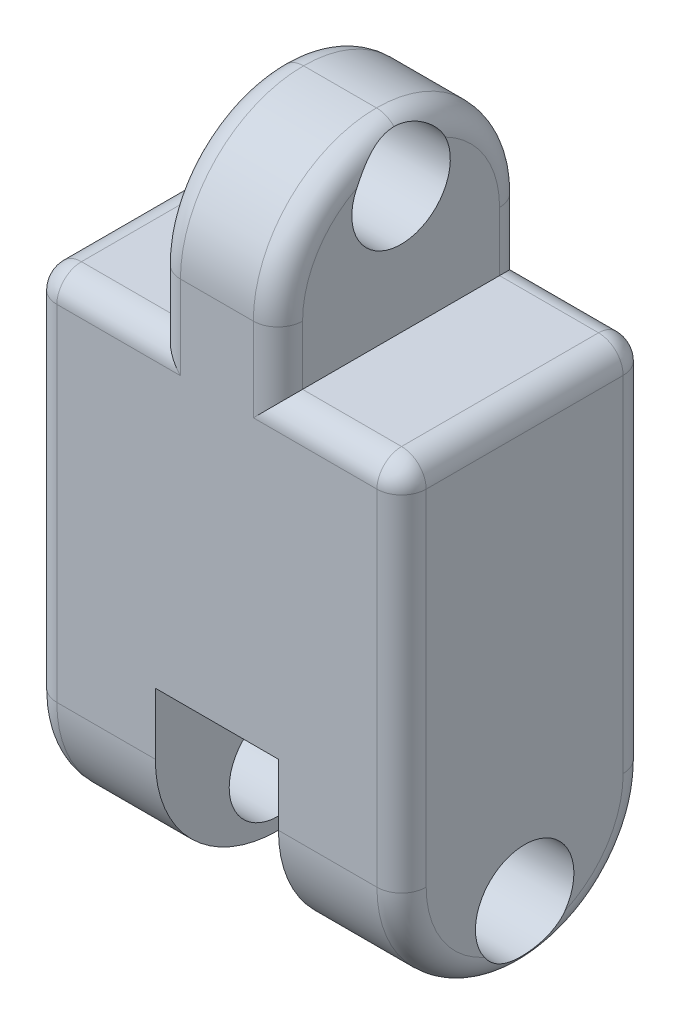
from build123d import *

# Parameters (mm, degrees)
BOSS_EXTRUDE1_DEPTH    = 100
SKETCH2_W              = 50
SKETCH2_H              = 50
CUT_EXTRUDE1_DEPTH     = 215.245186644
FILLET1_R              = 50
CUT_EXTRUDE2_DEPTH     = 25
SKETCH7_R              = 20
CUT_EXTRUDE3_DEPTH     = 251.551391934
FILLET2_R              = 50
CUT_EXTRUDE6_START     = -100
CUT_EXTRUDE6_OUTLINE_W = 50
CUT_EXTRUDE6_OUTLINE_H = 6.698729811
CUT_EXTRUDE6_DEPTH     = 50
CUT_EXTRUDE7_DEPTH     = 25
FILLET3_R              = 10
SKETCH11_W             = 50
SKETCH11_H             = 25
CUT_EXTRUDE8_DEPTH     = 99
BOSS_EXTRUDE7_DEPTH    = 0.1
FILLET4_R              = 10
FILLET5_R              = 10
SKETCH14_R             = 20
CUT_EXTRUDE9_DEPTH     = 225.178611948


with BuildPart() as part:
    # Sketch1 → Boss-Extrude1 (new body)
    with BuildSketch(Plane.XY):
        Polygon((-24.8, 100), (-24.8, 174), (24.8, 174), (24.8, 100), (75, 100), (75, -100), (-75, -100), (-75, 100), align=None)
    extrude(amount=-BOSS_EXTRUDE1_DEPTH)

    # Sketch2 → Cut-Extrude1 (cut, through all)
    with BuildSketch(Plane.XY):
        with Locations((0, -100)):
            Rectangle(SKETCH2_W, SKETCH2_H)
    extrude(amount=-CUT_EXTRUDE1_DEPTH, mode=Mode.SUBTRACT)

    # Fillet1
    fillet1_edges = [part.edges().sort_by_distance(p)[0] for p in [
        (0, 174, -100),
        (0, 174, 0),
    ]]
    fillet(fillet1_edges, radius=FILLET1_R - 0.0001)  # a hair under: the kernel refuses the full size

    # Sketch6 → Cut-Extrude2 (cut, symmetric)
    with BuildSketch(Plane(origin=(0, 0, 0), x_dir=(0, 0, -1), z_dir=(1, 0, 0))):
        with BuildLine():
            Line((100, -75), (0, -75))
            ThreePointArc((0, -75), (50, -25), (100, -75))
        make_face()
    extrude(amount=CUT_EXTRUDE2_DEPTH, both=True, mode=Mode.SUBTRACT)

    # Sketch7 → Cut-Extrude3 (cut, through all)
    with BuildSketch(Plane.ZY.offset(75)):
        with Locations(Location((-50, -75, 0), (0, 0, 270))):
            Circle(SKETCH7_R)
    extrude(amount=-CUT_EXTRUDE3_DEPTH, mode=Mode.SUBTRACT)

    # Fillet2
    fillet2_edges = [part.edges().sort_by_distance(p)[0] for p in [
        (-50, -100, -100),
        (-50, -100, 0),
    ]]
    fillet(fillet2_edges, radius=FILLET2_R - 0.0001)  # a hair under: the kernel refuses the full size

    # Cut-Extrude6: read off the stored shape, not the designer's step
    # Cut-Extrude6 outline → Cut-Extrude6 (cut)
    with BuildSketch(Plane(origin=(0, 0, 0), x_dir=(1, 0, 0), z_dir=(0, 1, 0)).offset(CUT_EXTRUDE6_START)):
        with Locations((0, 96.650635095)):
            Rectangle(CUT_EXTRUDE6_OUTLINE_W, CUT_EXTRUDE6_OUTLINE_H)
        with Locations((0, 3.349364906)):
            Rectangle(CUT_EXTRUDE6_OUTLINE_W, CUT_EXTRUDE6_OUTLINE_H)
    extrude(amount=CUT_EXTRUDE6_DEPTH, mode=Mode.SUBTRACT)

    # Sketch10 → Cut-Extrude7 (cut, symmetric)
    with BuildSketch(Plane(origin=(0, 0, 0), x_dir=(0, 0, -1), z_dir=(1, 0, 0))):
        with BuildLine():
            Line((0, -50), (100, -50))
            ThreePointArc((100, -50), (50, -36.611517322), (0, -50))
        make_face()
    extrude(amount=CUT_EXTRUDE7_DEPTH, both=True, mode=Mode.SUBTRACT)

    # Fillet3
    # the kernel refuses this fillet: 10 mm, written as the material it takes off along each edge
    with BuildSketch(Plane(origin=(24.8, 124.0001, -100), x_dir=(0, 0, 1), z_dir=(0, -1, 0)), Plane(origin=(-24.8, 100, 0), x_dir=(1, 0, 0), z_dir=(0, 1, 0)), Plane(origin=(-24.8, 100, -100), x_dir=(0, 0, 1), z_dir=(0, 1, 0)), Plane(origin=(24.8, 124.0001, 0), x_dir=(-1, 0, 0), z_dir=(0, -1, 0))) as fillet3_piece_1:
        with BuildLine():
            CenterArc((FILLET3_R, FILLET3_R), FILLET3_R, 180, 90)
            Line((0, FILLET3_R), (0, 0))
            Line((0, 0), (FILLET3_R, 0))
        make_face()
    extrude(amount=24.0001, mode=Mode.SUBTRACT)
    with BuildSketch(Plane(origin=(24.8, 100, 0), x_dir=(0, -1, 0), z_dir=(1, 0, 0)), Plane(origin=(-100, 100, -100), x_dir=(0, 0, 1), z_dir=(1, 0, 0)), Plane(origin=(24.8, 100, -100), x_dir=(0, 0, 1), z_dir=(1, 0, 0)), Plane(origin=(-100, 100, 0), x_dir=(0, -1, 0), z_dir=(1, 0, 0))) as fillet3_piece_2:
        with BuildLine():
            CenterArc((FILLET3_R, FILLET3_R), FILLET3_R, 180, 90)
            Line((0, FILLET3_R), (0, 0))
            Line((0, 0), (FILLET3_R, 0))
        make_face()
    extrude(amount=75.2, mode=Mode.SUBTRACT)
    with BuildSketch(Plane(origin=(-75, -50.0001, -100), x_dir=(0, 0, 1), z_dir=(0, 1, 0)), Plane(origin=(75, 125, 0), x_dir=(-1, 0, 0), z_dir=(0, -1, 0)), Plane(origin=(75, 125, -100), x_dir=(0, 0, 1), z_dir=(0, -1, 0)), Plane(origin=(-75, -50.0001, 0), x_dir=(1, 0, 0), z_dir=(0, 1, 0))) as fillet3_piece_3:
        with BuildLine():
            CenterArc((FILLET3_R, FILLET3_R), FILLET3_R, 180, 90)
            Line((0, FILLET3_R), (0, 0))
            Line((0, 0), (FILLET3_R, 0))
        make_face()
    extrude(amount=175.0001, mode=Mode.SUBTRACT)
    with BuildSketch(Plane(origin=(-24.8, 124.0001, -49.9999), x_dir=(0, 1, 0), z_dir=(0, 0, -1))) as fillet3_piece_4:
        with BuildLine():
            CenterArc((49.9999 - FILLET3_R, FILLET3_R), FILLET3_R, 270, 90)
            Line((49.9999 - FILLET3_R, 0), (49.9999, 0))
            Line((49.9999, 0), (49.9999, FILLET3_R))
        make_face()
    revolve(axis=Axis((-24.8, 124.0001, -49.9999), (1, 0, 0)), revolution_arc=90, mode=Mode.SUBTRACT)
    with BuildSketch(Plane(origin=(-24.8, 124.0001, -50.0001), x_dir=(0, 1, 0), z_dir=(0, 0, 1))) as fillet3_piece_5:
        with BuildLine():
            CenterArc((49.9999 - FILLET3_R, -FILLET3_R), FILLET3_R, 0, 90)
            Line((49.9999, -FILLET3_R), (49.9999, 0))
            Line((49.9999, 0), (49.9999 - FILLET3_R, 0))
        make_face()
    revolve(axis=Axis((-24.8, 124.0001, -50.0001), (-1, 0, 0)), revolution_arc=90, mode=Mode.SUBTRACT)
    with BuildSketch(Plane(origin=(24.8, 124.0001, -49.9999), x_dir=(0, 1, 0), z_dir=(0, 0, -1))) as fillet3_piece_6:
        with BuildLine():
            CenterArc((49.9999 - FILLET3_R, -FILLET3_R), FILLET3_R, 0, 90)
            Line((49.9999, -FILLET3_R), (49.9999, 0))
            Line((49.9999, 0), (49.9999 - FILLET3_R, 0))
        make_face()
    revolve(axis=Axis((24.8, 124.0001, -49.9999), (1, 0, 0)), revolution_arc=90, mode=Mode.SUBTRACT)
    with BuildSketch(Plane(origin=(24.8, 124.0001, -50.0001), x_dir=(0, 1, 0), z_dir=(0, 0, 1))) as fillet3_piece_7:
        with BuildLine():
            CenterArc((49.9999 - FILLET3_R, FILLET3_R), FILLET3_R, 270, 90)
            Line((49.9999, FILLET3_R), (49.9999, 0))
            Line((49.9999, 0), (49.9999 - FILLET3_R, 0))
        make_face()
    revolve(axis=Axis((24.8, 124.0001, -50.0001), (-1, 0, 0)), revolution_arc=90, mode=Mode.SUBTRACT)
    with BuildSketch(Plane(origin=(75, -50.0001, -49.9999), x_dir=(0, 0, 1), z_dir=(0, 1, 0))) as fillet3_piece_8:
        with BuildLine():
            CenterArc((49.9999 - FILLET3_R, -FILLET3_R), FILLET3_R, 0, 90)
            Line((49.9999, -FILLET3_R), (49.9999, 0))
            Line((49.9999, 0), (49.9999 - FILLET3_R, 0))
        make_face()
    revolve(axis=Axis((75, -50.0001, -49.9999), (1, 0, 0)), revolution_arc=90, mode=Mode.SUBTRACT)
    with BuildSketch(Plane(origin=(75, -50.0001, -50.0001), x_dir=(0, 0, -1), z_dir=(0, 1, 0))) as fillet3_piece_9:
        with BuildLine():
            CenterArc((49.9999 - FILLET3_R, FILLET3_R), FILLET3_R, 270, 90)
            Line((49.9999, FILLET3_R), (49.9999, 0))
            Line((49.9999, 0), (49.9999 - FILLET3_R, 0))
        make_face()
    revolve(axis=Axis((75, -50.0001, -50.0001), (-1, 0, 0)), revolution_arc=90, mode=Mode.SUBTRACT)
    with BuildSketch(Plane(origin=(-75, -50.0001, -49.9999), x_dir=(0, 0, 1), z_dir=(0, 1, 0))) as fillet3_piece_10:
        with BuildLine():
            CenterArc((49.9999 - FILLET3_R, FILLET3_R), FILLET3_R, 270, 90)
            Line((49.9999, FILLET3_R), (49.9999, 0))
            Line((49.9999, 0), (49.9999 - FILLET3_R, 0))
        make_face()
    revolve(axis=Axis((-75, -50.0001, -49.9999), (1, 0, 0)), revolution_arc=90, mode=Mode.SUBTRACT)
    with BuildSketch(Plane(origin=(-75, -50.0001, -50.0001), x_dir=(0, 0, -1), z_dir=(0, 1, 0))) as fillet3_piece_11:
        with BuildLine():
            CenterArc((49.9999 - FILLET3_R, -FILLET3_R), FILLET3_R, 0, 90)
            Line((49.9999, -FILLET3_R), (49.9999, 0))
            Line((49.9999, 0), (49.9999 - FILLET3_R, 0))
        make_face()
    revolve(axis=Axis((-75, -50.0001, -50.0001), (-1, 0, 0)), revolution_arc=90, mode=Mode.SUBTRACT)
    with BuildSketch(Plane(origin=(-75, -100, -49.9999), x_dir=(0, 1, 0), z_dir=(0, 0, -1)), Plane(origin=(24.8, 174, -49.9999), x_dir=(0, -1, 0), z_dir=(0, 0, -1))) as fillet3_piece_12:
        with BuildLine():
            CenterArc((FILLET3_R, FILLET3_R), FILLET3_R, 180, 90)
            Line((0, FILLET3_R), (0, 0))
            Line((0, 0), (FILLET3_R, 0))
        make_face()
    extrude(amount=0.0002, mode=Mode.SUBTRACT)
    with BuildSketch(Plane(origin=(75, -100, -49.9999), x_dir=(0, 1, 0), z_dir=(0, 0, -1)), Plane(origin=(-24.8, 174, -49.9999), x_dir=(0, -1, 0), z_dir=(0, 0, -1))) as fillet3_piece_13:
        with BuildLine():
            CenterArc((FILLET3_R, -FILLET3_R), FILLET3_R, 90, 90)
            Line((0, -FILLET3_R), (0, 0))
            Line((0, 0), (FILLET3_R, 0))
        make_face()
    extrude(amount=0.0002, mode=Mode.SUBTRACT)
    with BuildSketch(Plane(origin=(-0.2, 100, -100), x_dir=(0, 0, 1), z_dir=(1, 0, 0))) as fillet3_piece_14a_section:
        with BuildLine():
            CenterArc((FILLET3_R, FILLET3_R), FILLET3_R, 180, 90)
            Line((0, FILLET3_R), (0, 0))
            Line((0, 0), (FILLET3_R, 0))
        make_face()
    fillet3_piece_14a = extrude(amount=100.2, mode=Mode.PRIVATE)
    fillet3_piece_14a = split(fillet3_piece_14a, bisect_by=Plane(origin=(24.8, 100, -100), z_dir=(-1, 0, 0)), keep=Keep.TOP, mode=Mode.PRIVATE)
    with BuildSketch(Plane(origin=(24.8, 124.0001, -100), x_dir=(0, 0, 1), z_dir=(0, -1, 0))) as fillet3_piece_14b_section:
        with BuildLine():
            CenterArc((FILLET3_R, FILLET3_R), FILLET3_R, 180, 90)
            Line((0, FILLET3_R), (0, 0))
            Line((0, 0), (FILLET3_R, 0))
        make_face()
    fillet3_piece_14b = extrude(amount=49.0001, mode=Mode.PRIVATE)
    fillet3_piece_14b = split(fillet3_piece_14b, bisect_by=Plane(origin=(24.8, 100, -100), z_dir=(0, -1, 0)), keep=Keep.TOP, mode=Mode.PRIVATE)
    fillet3_piece_14 = fillet3_piece_14a & fillet3_piece_14b
    add(fillet3_piece_14, mode=Mode.SUBTRACT)
    with BuildSketch(Plane(origin=(-0.2, 100, 0), x_dir=(0, -1, 0), z_dir=(1, 0, 0))) as fillet3_piece_15a_section:
        with BuildLine():
            CenterArc((FILLET3_R, FILLET3_R), FILLET3_R, 180, 90)
            Line((0, FILLET3_R), (0, 0))
            Line((0, 0), (FILLET3_R, 0))
        make_face()
    fillet3_piece_15a = extrude(amount=100.2, mode=Mode.PRIVATE)
    fillet3_piece_15a = split(fillet3_piece_15a, bisect_by=Plane(origin=(24.8, 100, 0), z_dir=(-1, 0, 0)), keep=Keep.TOP, mode=Mode.PRIVATE)
    with BuildSketch(Plane(origin=(24.8, 124.0001, 0), x_dir=(-1, 0, 0), z_dir=(0, -1, 0))) as fillet3_piece_15b_section:
        with BuildLine():
            CenterArc((FILLET3_R, FILLET3_R), FILLET3_R, 180, 90)
            Line((0, FILLET3_R), (0, 0))
            Line((0, 0), (FILLET3_R, 0))
        make_face()
    fillet3_piece_15b = extrude(amount=49.0001, mode=Mode.PRIVATE)
    fillet3_piece_15b = split(fillet3_piece_15b, bisect_by=Plane(origin=(24.8, 100, 0), z_dir=(0, -1, 0)), keep=Keep.TOP, mode=Mode.PRIVATE)
    fillet3_piece_15 = fillet3_piece_15a & fillet3_piece_15b
    add(fillet3_piece_15, mode=Mode.SUBTRACT)
    with BuildSketch(Plane(origin=(-24.8, 75, -100), x_dir=(0, 0, 1), z_dir=(0, 1, 0))) as fillet3_piece_16a_section:
        with BuildLine():
            CenterArc((FILLET3_R, FILLET3_R), FILLET3_R, 180, 90)
            Line((0, FILLET3_R), (0, 0))
            Line((0, 0), (FILLET3_R, 0))
        make_face()
    fillet3_piece_16a = extrude(amount=49.0001, mode=Mode.PRIVATE)
    fillet3_piece_16a = split(fillet3_piece_16a, bisect_by=Plane(origin=(-24.8, 100, -100), z_dir=(0, -1, 0)), keep=Keep.TOP, mode=Mode.PRIVATE)
    with BuildSketch(Plane(origin=(-100, 100, -100), x_dir=(0, 0, 1), z_dir=(1, 0, 0))) as fillet3_piece_16b_section:
        with BuildLine():
            CenterArc((FILLET3_R, FILLET3_R), FILLET3_R, 180, 90)
            Line((0, FILLET3_R), (0, 0))
            Line((0, 0), (FILLET3_R, 0))
        make_face()
    fillet3_piece_16b = extrude(amount=100.2, mode=Mode.PRIVATE)
    fillet3_piece_16b = split(fillet3_piece_16b, bisect_by=Plane(origin=(-24.8, 100, -100), z_dir=(1, 0, 0)), keep=Keep.TOP, mode=Mode.PRIVATE)
    fillet3_piece_16 = fillet3_piece_16a & fillet3_piece_16b
    add(fillet3_piece_16, mode=Mode.SUBTRACT)
    with BuildSketch(Plane(origin=(-24.8, 75, 0), x_dir=(1, 0, 0), z_dir=(0, 1, 0))) as fillet3_piece_17a_section:
        with BuildLine():
            CenterArc((FILLET3_R, FILLET3_R), FILLET3_R, 180, 90)
            Line((0, FILLET3_R), (0, 0))
            Line((0, 0), (FILLET3_R, 0))
        make_face()
    fillet3_piece_17a = extrude(amount=49.0001, mode=Mode.PRIVATE)
    fillet3_piece_17a = split(fillet3_piece_17a, bisect_by=Plane(origin=(-24.8, 100, 0), z_dir=(0, -1, 0)), keep=Keep.TOP, mode=Mode.PRIVATE)
    with BuildSketch(Plane(origin=(-100, 100, 0), x_dir=(0, -1, 0), z_dir=(1, 0, 0))) as fillet3_piece_17b_section:
        with BuildLine():
            CenterArc((FILLET3_R, FILLET3_R), FILLET3_R, 180, 90)
            Line((0, FILLET3_R), (0, 0))
            Line((0, 0), (FILLET3_R, 0))
        make_face()
    fillet3_piece_17b = extrude(amount=100.2, mode=Mode.PRIVATE)
    fillet3_piece_17b = split(fillet3_piece_17b, bisect_by=Plane(origin=(-24.8, 100, 0), z_dir=(1, 0, 0)), keep=Keep.TOP, mode=Mode.PRIVATE)
    fillet3_piece_17 = fillet3_piece_17a & fillet3_piece_17b
    add(fillet3_piece_17, mode=Mode.SUBTRACT)

    # Sketch11 → Cut-Extrude8 (cut)
    with BuildSketch(Plane.XY):
        with Locations((0, -37.5)):
            Rectangle(SKETCH11_W, SKETCH11_H)
    extrude(amount=-CUT_EXTRUDE8_DEPTH, mode=Mode.SUBTRACT)

    # Fillet5
    # the kernel refuses this fillet: 10 mm, written as the material it takes off along each edge
    with BuildSketch(Plane(origin=(65, 90, -10), x_dir=(0, 1, 0), z_dir=(1, 0, 0))) as fillet5_piece_1_section:
        Polygon((0, 0), (FILLET5_R, 0), (FILLET5_R, FILLET5_R), (0, FILLET5_R), align=None)
    fillet5_piece_1 = extrude(amount=FILLET5_R, mode=Mode.PRIVATE)
    fillet5_piece_1 = fillet5_piece_1 - Plane(origin=(65, 90, -10), x_dir=(0, -0.7071067811865475, -0.7071067811865475), z_dir=(1, 0, 0)) * Sphere(FILLET5_R, mode=Mode.PRIVATE)
    add(fillet5_piece_1, mode=Mode.SUBTRACT)
    with BuildSketch(Plane(origin=(65, 90, -90), x_dir=(0, 1, 0), z_dir=(1, 0, 0))) as fillet5_piece_2_section:
        Polygon((0, 0), (FILLET5_R, 0), (FILLET5_R, -FILLET5_R), (0, -FILLET5_R), align=None)
    fillet5_piece_2 = extrude(amount=FILLET5_R, mode=Mode.PRIVATE)
    fillet5_piece_2 = fillet5_piece_2 - Plane(origin=(65, 90, -90), x_dir=(0, -0.7071067811865475, 0.7071067811865475), z_dir=(1, 0, 0)) * Sphere(FILLET5_R, mode=Mode.PRIVATE)
    add(fillet5_piece_2, mode=Mode.SUBTRACT)
    with BuildSketch(Plane(origin=(-65, 90, -90), x_dir=(0, 1, 0), z_dir=(-1, 0, 0))) as fillet5_piece_3_section:
        Polygon((0, 0), (FILLET5_R, 0), (FILLET5_R, FILLET5_R), (0, FILLET5_R), align=None)
    fillet5_piece_3 = extrude(amount=FILLET5_R, mode=Mode.PRIVATE)
    fillet5_piece_3 = fillet5_piece_3 - Plane(origin=(-65, 90, -90), x_dir=(0, -0.7071067811865475, 0.7071067811865475), z_dir=(-1, 0, 0)) * Sphere(FILLET5_R, mode=Mode.PRIVATE)
    add(fillet5_piece_3, mode=Mode.SUBTRACT)
    with BuildSketch(Plane(origin=(-65, 90, -10), x_dir=(0, 1, 0), z_dir=(-1, 0, 0))) as fillet5_piece_4_section:
        Polygon((0, 0), (FILLET5_R, 0), (FILLET5_R, -FILLET5_R), (0, -FILLET5_R), align=None)
    fillet5_piece_4 = extrude(amount=FILLET5_R, mode=Mode.PRIVATE)
    fillet5_piece_4 = fillet5_piece_4 - Plane(origin=(-65, 90, -10), x_dir=(0, -0.7071067811865475, -0.7071067811865475), z_dir=(-1, 0, 0)) * Sphere(FILLET5_R, mode=Mode.PRIVATE)
    add(fillet5_piece_4, mode=Mode.SUBTRACT)
    with BuildSketch(Plane(origin=(75, 100, -10), x_dir=(0, -1, 0), z_dir=(0, 0, -1))) as fillet5_piece_5:
        with BuildLine():
            CenterArc((FILLET5_R, FILLET5_R), FILLET5_R, 180, 90)
            Line((0, FILLET5_R), (0, 0))
            Line((0, 0), (FILLET5_R, 0))
        make_face()
    extrude(amount=80, mode=Mode.SUBTRACT)
    with BuildSketch(Plane(origin=(-75, 100, -10), x_dir=(0, -1, 0), z_dir=(0, 0, -1))) as fillet5_piece_6:
        with BuildLine():
            CenterArc((FILLET5_R, -FILLET5_R), FILLET5_R, 90, 90)
            Line((0, -FILLET5_R), (0, 0))
            Line((0, 0), (FILLET5_R, 0))
        make_face()
    extrude(amount=80, mode=Mode.SUBTRACT)

    # Sketch14 → Cut-Extrude9 (cut, through all)
    with BuildSketch(Plane(origin=(24.8, 0, 0), x_dir=(0, 0, -1), z_dir=(1, 0, 0))):
        with Locations(Location((50, 151, 0), (0, 0, 25.856016698))):
            Circle(SKETCH14_R)
    extrude(amount=-CUT_EXTRUDE9_DEPTH, mode=Mode.SUBTRACT)


with BuildPart() as body_2:
    # Sketch13 → Boss-Extrude7 (new body)
    with BuildSketch(Plane(origin=(0, 0, -100), x_dir=(-1, 0, 0), z_dir=(0, 0, -1))):
        Polygon((-25, -50), (-25, -80), (25.018802851, -80), (25, -50), align=None)
    extrude(amount=BOSS_EXTRUDE7_DEPTH)

    # Fillet4
    # the kernel refuses this fillet: 10 mm, written as the material it takes off along each edge
    with BuildSketch(Plane(origin=(-25.021013242, -83.526683302, -100.1), x_dir=(0, 0, 1), z_dir=(0.0006267615930631998, 0.9999998035849335, 0))) as fillet4_piece_1:
        with BuildLine():
            CenterArc((10, 1.410673598), FILLET4_R, 180, 8.109614456)
            Line((0, 1.410673598), (0, 0))
            Line((0, 0), (0.1, 0))
        make_face()
    extrude(amount=37.053373882, mode=Mode.SUBTRACT)
    with BuildSketch(Plane(origin=(25, -46.473316005, -100.1), x_dir=(0, 0, 1), z_dir=(0, -1, 0))) as fillet4_piece_2:
        with BuildLine():
            CenterArc((10, 1.410673598), FILLET4_R, 180, 8.109614456)
            Line((0, 1.410673598), (0, 0))
            Line((0, 0), (0.1, 0))
        make_face()
    extrude(amount=37.05336799, mode=Mode.SUBTRACT)
    with BuildSketch(Plane(origin=(28.526683995, -80, -100.1), x_dir=(0, 0, 1), z_dir=(-1, 0, 0))) as fillet4_piece_3:
        with BuildLine():
            CenterArc((10, 1.410673598), FILLET4_R, 180, 8.109614456)
            Line((0, 1.410673598), (0, 0))
            Line((0, 0), (0.1, 0))
        make_face()
    extrude(amount=57.072170841, mode=Mode.SUBTRACT)


solid = Compound([part.part, body_2.part])
